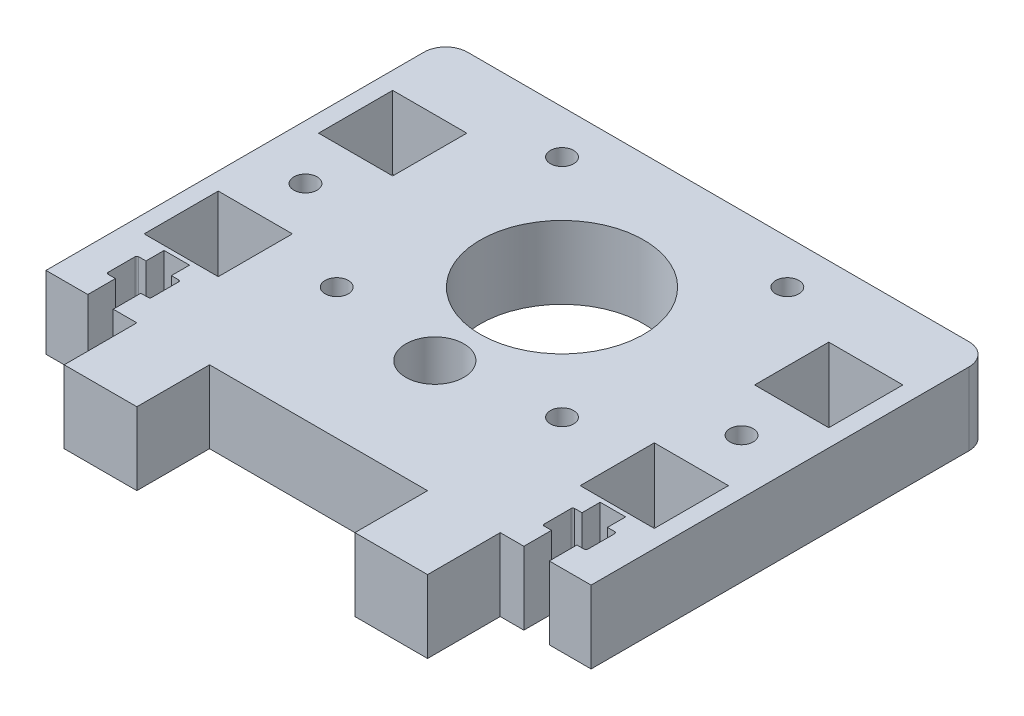
from build123d import *

# Parameters (mm, degrees)
SKETCH1_R        = 1.6
SKETCH1_W        = 10.2
SKETCH1_H        = 10.2
MAINLAYOUT_DEPTH = 10
TSLOT_DEPTH      = 53.936282454


with BuildPart() as part:
    # Sketch1 → MainLayout (new body)
    with BuildSketch(Plane(origin=(0, 0, 0), x_dir=(1, 0, 0), z_dir=(0, 1, 0))):
        with BuildLine():
            Line((-34.5, 29), (0, 29))
            Line((0, 29), (0, 18.75))
            ThreePointArc((0, 18.75), (-11.25, 7.5), (0, -3.75))
            Line((0, -3.75), (0, -6))
            ThreePointArc((0, -6), (-4, -10), (0, -14))
            Line((0, -14), (0, -26))
            Line((0, -26), (-15, -26))
            Line((-15, -26), (-15, -36))
            Line((-15, -36), (-25, -36))
            Line((-25, -36), (-25, -26))
            Line((-25, -26), (-37.5, -26))
            Line((-37.5, -26), (-37.5, 26))
            ThreePointArc((-37.5, 26), (-36.621320344, 28.121320344), (-34.5, 29))
        make_face()
        with Locations((-15.5, 23)):
            Circle(SKETCH1_R, mode=Mode.SUBTRACT)
        with Locations((-15.5, -8)):
            Circle(SKETCH1_R, mode=Mode.SUBTRACT)
        with Locations((-30, 2.2)):
            Circle(SKETCH1_R, mode=Mode.SUBTRACT)
        with Locations((-30, 14.2)):
            Rectangle(SKETCH1_W, SKETCH1_H, mode=Mode.SUBTRACT)
        with Locations((-30, -9.8)):
            Rectangle(SKETCH1_W, SKETCH1_H, mode=Mode.SUBTRACT)
    mainlayout = extrude(amount=MAINLAYOUT_DEPTH)

    # Sketch2 → TSlot (cut, through all)
    with BuildSketch(Plane(origin=(0, 10, 0), x_dir=(1, 0, 0), z_dir=(0, 1, 0))):
        with BuildLine():
            Line((-28.25, -22.2), (-28.25, -26))
            Line((-28.25, -26), (-31.75, -26))
            Line((-31.75, -26), (-31.75, -22.2))
            Line((-31.75, -22.2), (-32.75, -22.2))
            ThreePointArc((-32.75, -22.2), (-32.926776695, -22.126776695), (-33, -21.95))
            Line((-33, -21.95), (-33, -18.25))
            ThreePointArc((-33, -18.25), (-32.926776695, -18.073223305), (-32.75, -18))
            Line((-32.75, -18), (-31.75, -18))
            Line((-31.75, -18), (-31.75, -15.5))
            Line((-31.75, -15.5), (-28.25, -15.5))
            Line((-28.25, -15.5), (-28.25, -18))
            Line((-28.25, -18), (-27.25, -18))
            ThreePointArc((-27.25, -18), (-27.073223305, -18.073223305), (-27, -18.25))
            Line((-27, -18.25), (-27, -21.95))
            ThreePointArc((-27, -21.95), (-27.073223305, -22.126776695), (-27.25, -22.2))
            Line((-27.25, -22.2), (-28.25, -22.2))
        make_face()
    tslot = extrude(amount=-TSLOT_DEPTH, mode=Mode.SUBTRACT)

    # Mirror1: MainLayout, TSlot across plane
    add(mainlayout.mirror(Plane(origin=(0, 0, 0), x_dir=(0, 0, 1), z_dir=(1, 0, 0))))
    add(tslot.mirror(Plane(origin=(0, 0, 0), x_dir=(0, 0, 1), z_dir=(1, 0, 0))), mode=Mode.SUBTRACT)


solid = part.part
